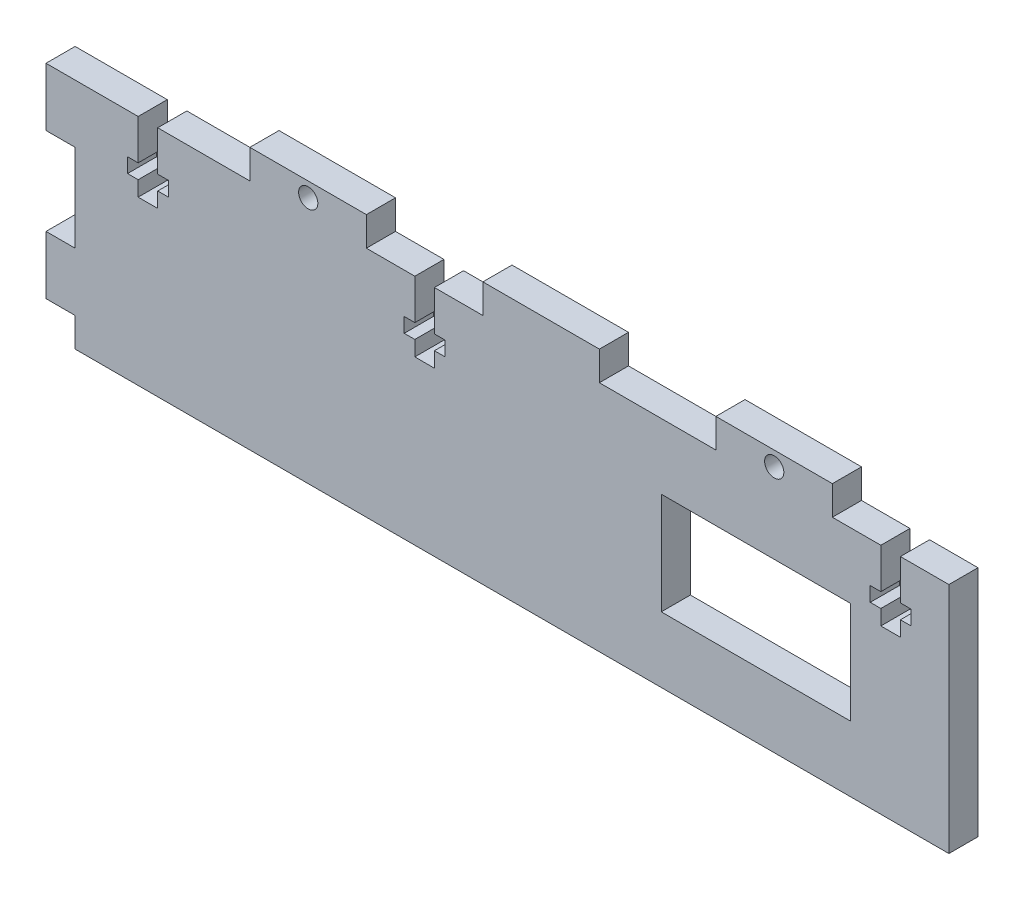
from build123d import *

# Parameters (mm, degrees)
SKETCH1_W           = 190.5
SKETCH1_H           = 50.8
BOSS_EXTRUDE1_DEPTH = 6.35
SKETCH2_W           = 41.275
SKETCH2_H           = 22.225
CUT_EXTRUDE1_DEPTH  = 151.724377554
SKETCH3_W           = 25.4
SKETCH3_H           = 6.35
BOSS_EXTRUDE2_DEPTH = 6.35
LPATTERN1_COUNT     = 3
LPATTERN1_PITCH     = 50.8
SKETCH4_W           = 6.35
SKETCH4_H           = 12.7
BOSS_EXTRUDE3_DEPTH = 6.35
LPATTERN2_COUNT     = 2
LPATTERN2_PITCH     = 31.75
CUT_EXTRUDE2_DEPTH  = 6.35
SKETCH6_R           = 2.0955
CUT_EXTRUDE3_DEPTH  = 159.133368044


with BuildPart() as part:
    # Sketch1 → Boss-Extrude1 (new body)
    with BuildSketch(Plane.XY):
        with Locations((-53.183, 0)):
            Rectangle(SKETCH1_W, SKETCH1_H)
    extrude(amount=BOSS_EXTRUDE1_DEPTH)

    # Sketch2 → Cut-Extrude1 (cut, through all)
    with BuildSketch(Plane.XY.offset(6.35)):
        Rectangle(SKETCH2_W, SKETCH2_H)
    extrude(amount=-CUT_EXTRUDE1_DEPTH, mode=Mode.SUBTRACT)

    # Sketch3 → Boss-Extrude2 (add)
    with BuildSketch(Plane(origin=(0, 25.4, 0), x_dir=(1, 0, 0), z_dir=(0, 1, 0))):
        with Locations((3.967, -3.175)):
            Rectangle(SKETCH3_W, SKETCH3_H)
    boss_extrude2 = extrude(amount=BOSS_EXTRUDE2_DEPTH)

    # LPattern1: Boss-Extrude2 ×3
    with Locations(*[(-i * LPATTERN1_PITCH, 0, 0) for i in range(1, LPATTERN1_COUNT)]):
        add(boss_extrude2)

    # Sketch4 → Boss-Extrude3 (add)
    with BuildSketch(Plane.ZY.offset(148.433)):
        with Locations((3.175, 19.05)):
            Rectangle(SKETCH4_W, SKETCH4_H)
    boss_extrude3 = extrude(amount=BOSS_EXTRUDE3_DEPTH)

    # LPattern2: Boss-Extrude3 ×2
    with Locations(*[(0, -i * LPATTERN2_PITCH, 0) for i in range(1, LPATTERN2_COUNT)]):
        add(boss_extrude3)

    # Sketch5 → Cut-Extrude2 (cut)
    with BuildSketch(Plane.XY.offset(6.35)):
        Polygon((31.5006, 25.4), (27.2334, 25.4), (27.2334, 16.637), (24.922, 16.637), (24.922, 13.462), (27.2334, 13.462), (27.2334, 10.16), (31.5006, 10.16), (31.5006, 13.462), (33.812, 13.462), (33.812, 16.637), (31.5006, 16.637), align=None)
        Polygon((-70.0994, 25.4), (-74.3666, 25.4), (-74.3666, 16.637), (-76.678, 16.637), (-76.678, 13.462), (-74.3666, 13.462), (-74.3666, 10.16), (-70.0994, 10.16), (-70.0994, 13.462), (-67.788, 13.462), (-67.788, 16.637), (-70.0994, 16.637), align=None)
        Polygon((-130.4244, 25.4), (-134.6916, 25.4), (-134.6916, 16.637), (-137.003, 16.637), (-137.003, 13.462), (-134.6916, 13.462), (-134.6916, 10.16), (-130.4244, 10.16), (-130.4244, 13.462), (-128.113, 13.462), (-128.113, 16.637), (-130.4244, 16.637), align=None)
    extrude(amount=-CUT_EXTRUDE2_DEPTH, mode=Mode.SUBTRACT)

    # Sketch6 → Cut-Extrude3 (cut, through all)
    with BuildSketch(Plane(origin=(0, 0, 0), x_dir=(-1, 0, 0), z_dir=(0, 0, -1))):
        with Locations((-3.98760291, 28.575)):
            Circle(SKETCH6_R)
        with Locations((97.61239709, 28.575)):
            Circle(SKETCH6_R)
    extrude(amount=-CUT_EXTRUDE3_DEPTH, mode=Mode.SUBTRACT)


solid = part.part
